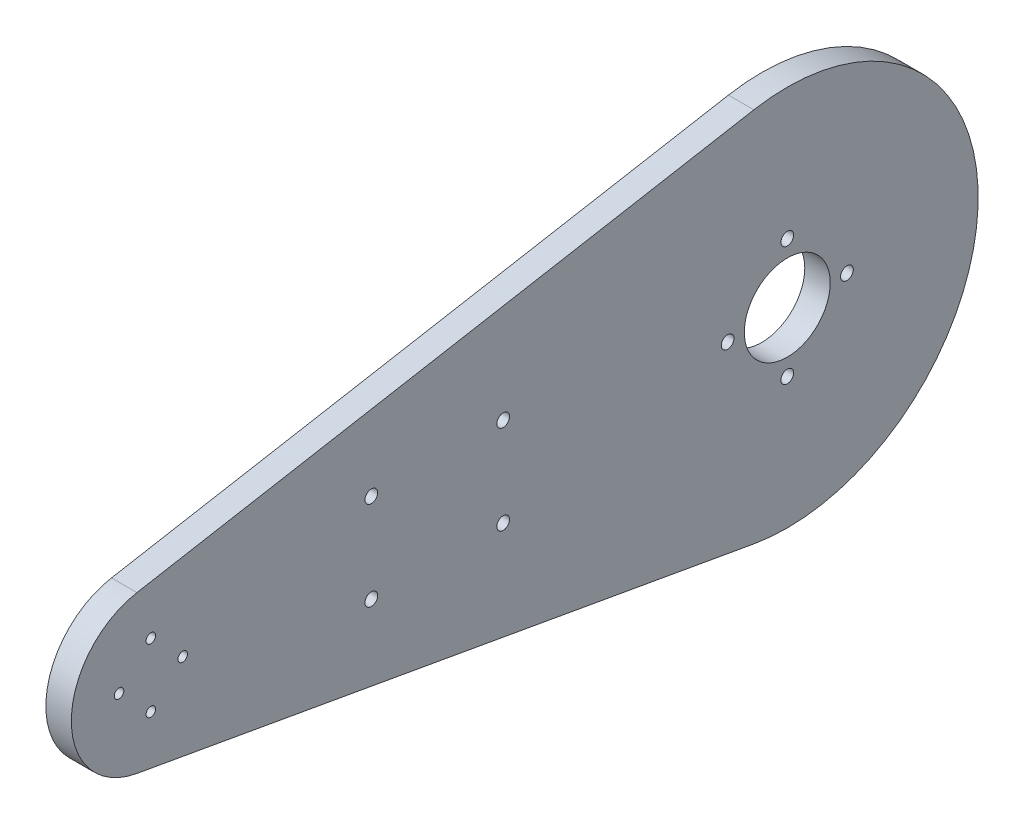
from build123d import *

# Parameters (mm, degrees)
SKETCH1_R           = 13.5
BOSS_EXTRUDE1_DEPTH = 4
SKETCH2_R           = 2
SKETCH2_R_2         = 1.5
CUT_EXTRUDE1_DEPTH  = 234
SKETCH3_R           = 2
CUT_EXTRUDE2_DEPTH  = 234


with BuildPart() as part:
    # Sketch1 → Boss-Extrude1 (new, symmetric)
    with BuildSketch(Plane(origin=(0, 0, 0), x_dir=(0, 0, -1), z_dir=(1, 0, 0))):
        with BuildLine():
            Line((-204.375, 24.614210834), (-10.5, 59.074106003))
            ThreePointArc((-10.5, 59.074106003), (60, 0), (-10.5, -59.074106003))
            Line((-10.5, -59.074106003), (-204.375, -24.614210834))
            ThreePointArc((-204.375, -24.614210834), (-225, 0), (-204.375, 24.614210834))
        make_face()
        Circle(SKETCH1_R, mode=Mode.SUBTRACT)
    extrude(amount=BOSS_EXTRUDE1_DEPTH, both=True)

    # Sketch2 → Cut-Extrude1 (cut, through all)
    with BuildSketch(Plane(origin=(4, 0, 0), x_dir=(0, 0, -1), z_dir=(1, 0, 0))):
        with Locations((0, 18.75)):
            Circle(SKETCH2_R)
        with Locations((18.75, 0)):
            Circle(SKETCH2_R)
        with Locations((0, -18.75)):
            Circle(SKETCH2_R)
        with Locations((-18.75, 0)):
            Circle(SKETCH2_R)
        with Locations((-210, 0)):
            Circle(SKETCH2_R_2)
        with Locations((-199.999998892, 10)):
            Circle(SKETCH2_R_2)
        with Locations((-189.999998892, -1.108e-06)):
            Circle(SKETCH2_R_2)
        with Locations((-200, -10.000001108)):
            Circle(SKETCH2_R_2)
    extrude(amount=-CUT_EXTRUDE1_DEPTH, mode=Mode.SUBTRACT)

    # Sketch3 → Cut-Extrude2 (cut, through all)
    with BuildSketch(Plane(origin=(4, 0, 0), x_dir=(0, 0, -1), z_dir=(1, 0, 0))):
        with Locations((-89.287684823, 14)):
            Circle(SKETCH3_R)
        with Locations((-89.287684823, -14)):
            Circle(SKETCH3_R)
        with Locations((-130.712315177, 14)):
            Circle(SKETCH3_R)
        with Locations((-130.712315177, -14)):
            Circle(SKETCH3_R)
    extrude(amount=-CUT_EXTRUDE2_DEPTH, mode=Mode.SUBTRACT)


solid = part.part
